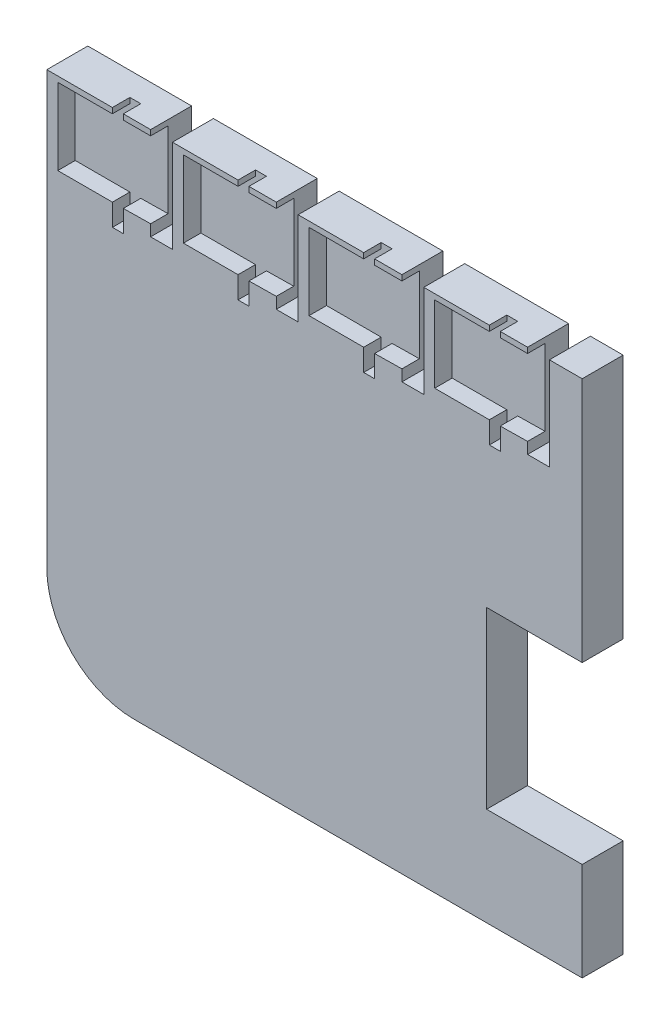
from build123d import *

# Parameters (mm, degrees)
BOSS_EXTRUDE1_DEPTH = 7.5
SKETCH38_W          = 4
SKETCH38_H          = 7.5
CUT_EXTRUDE28_DEPTH = 17
CUT_EXTRUDE1_DEPTH  = 3.2


with BuildPart() as part:
    # Sketch1 → Boss-Extrude1 (new body)
    with BuildSketch(Plane.XY):
        with BuildLine():
            Line((-33, -47.5), (49, -47.5))
            Line((49, -47.5), (49, -29.5))
            Line((49, -29.5), (31.5, -29.5))
            Line((31.5, -29.5), (31.5, 2.5))
            Line((31.5, 2.5), (49, 2.5))
            Line((49, 2.5), (49, 47.5))
            Line((49, 47.5), (30, 47.5))
            Line((30, 47.5), (27, 47.5))
            Line((27, 47.5), (-49, 47.5))
            Line((-49, 47.5), (-49, -31.5))
            ThreePointArc((-49, -31.5), (-44.313708499, -42.813708499), (-33, -47.5))
        make_face()
    extrude(amount=BOSS_EXTRUDE1_DEPTH)

    # Sketch38 → Cut-Extrude28 (cut)
    with BuildSketch(Plane(origin=(0, 47.5, 0), x_dir=(1, 0, 0), z_dir=(0, 1, 0))):
        with Locations((-28, -3.75)):
            Rectangle(SKETCH38_W, SKETCH38_H)
        with Locations((-5, -3.75)):
            Rectangle(SKETCH38_W, SKETCH38_H)
        with Locations((18, -3.75)):
            Rectangle(SKETCH38_W, SKETCH38_H)
        with Locations((41, -3.75)):
            Rectangle(SKETCH38_W, SKETCH38_H)
    extrude(amount=-CUT_EXTRUDE28_DEPTH, mode=Mode.SUBTRACT)

    # Sketch2 → Cut-Extrude1 (cut)
    with BuildSketch(Plane.XY.offset(7.5)):
        Polygon((-30, 45.071597386), (-30, 40.071597386), (-30, 32.571597386), (-34.999487352, 32.499999775), (-34.999487352, 28.499999775), (-37.000829904, 28.499999775), (-37.000829904, 32.499999775), (-47.000829904, 32.499999775), (-47.000829904, 46.499999775), (-37.000829904, 46.499999775), (-37.000829904, 47.5), (-34.999487352, 47.5), (-34.999487352, 46.499999775), (-30, 46.499999775), align=None)
        Polygon((-24.000829904, 32.499999775), (-24.000829904, 46.499999775), (-14.000829904, 46.499999775), (-14.000829904, 47.5), (-11.999487352, 47.5), (-11.999487352, 46.499999775), (-7, 46.499999775), (-7, 45.071597386), (-7, 40.071597386), (-7, 32.571597386), (-11.999487352, 32.499999775), (-11.999487352, 28.499999775), (-14.000829904, 28.499999775), (-14.000829904, 32.499999775), align=None)
        Polygon((-1.000829904, 32.499999775), (-1.000829904, 46.499999775), (8.999170096, 46.499999775), (8.999170096, 47.5), (11.000512648, 47.5), (11.000512648, 46.499999775), (16, 46.499999775), (16, 45.071597386), (16, 40.071597386), (16, 32.571597386), (11.000512648, 32.499999775), (11.000512648, 28.499999775), (8.999170096, 28.499999775), (8.999170096, 32.499999775), align=None)
        Polygon((21.999170096, 32.499999775), (21.999170096, 46.499999775), (31.999170096, 46.499999775), (31.999170096, 47.5), (34.000512648, 47.5), (34.000512648, 46.499999775), (39, 46.499999775), (39, 45.071597386), (39, 40.071597386), (39, 32.571597386), (34.000512648, 32.499999775), (34.000512648, 28.499999775), (31.999170096, 28.499999775), (31.999170096, 32.499999775), align=None)
    extrude(amount=-CUT_EXTRUDE1_DEPTH, mode=Mode.SUBTRACT)


solid = part.part
